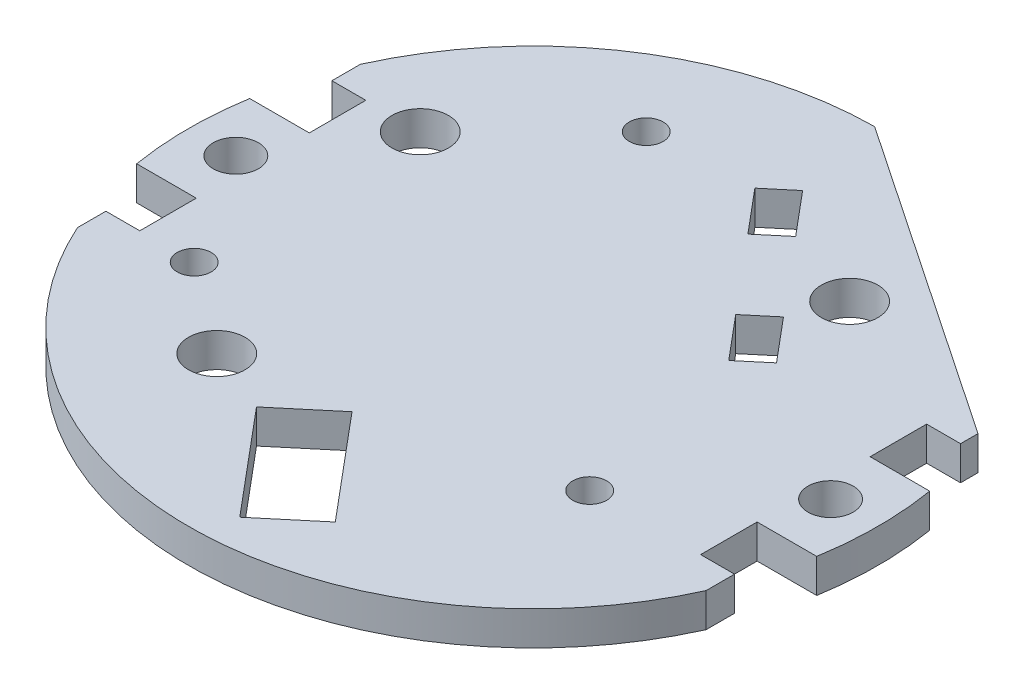
from build123d import *

# Parameters (mm, degrees)
CROQUIS1_R              = 30.5
SALIENTE_EXTRUIR1_DEPTH = 3
CORTAR_EXTRUIR3_START   = -4
CORTAR_EXTRUIR3_DEPTH   = 4
CORTAR_EXTRUIR5_DEPTH   = 4
CROQUIS8_R              = 2.5
CORTAR_EXTRUIR6_DEPTH   = 10
CROQUIS9_R              = 1.5
CORTAR_EXTRUIR7_DEPTH   = 3
CORTAR_EXTRUIR8_START   = -3
CROQUIS10_R             = 2
CORTAR_EXTRUIR8_DEPTH   = 3
CORTAR_EXTRUIR9_START   = -3
CROQUIS11_R             = 2.5
CORTAR_EXTRUIR9_DEPTH   = 3


with BuildPart() as part:
    # Croquis1 → Saliente-Extruir1 (new body)
    with BuildSketch(Plane(origin=(0, 0, 0), x_dir=(1, 0, 0), z_dir=(0, 1, 0))):
        Circle(CROQUIS1_R)
    extrude(amount=SALIENTE_EXTRUIR1_DEPTH)

    # Croquis5 → Cortar-Extruir3 (cut)
    with BuildSketch(Plane(origin=(0, 3, 0), x_dir=(1, 0, 0), z_dir=(0, 1, 0)).offset(CORTAR_EXTRUIR3_START)):
        with BuildLine():
            Line((30.087372767, -5), (24.814059068, -5))
            Line((24.814059068, -5), (24.814059068, -10))
            Line((24.814059068, -10), (28.814059068, -10))
            ThreePointArc((28.814059068, -10), (29.556634924, -7.526973624), (30.087372767, -5))
        make_face()
        with BuildLine():
            Line((24.814059068, 5), (30.087372767, 5))
            ThreePointArc((30.087372767, 5), (29.556634924, 7.526973624), (28.814059068, 10))
            Line((28.814059068, 10), (24.814059068, 10))
            Line((24.814059068, 10), (24.814059068, 5))
        make_face()
        with BuildLine():
            ThreePointArc((-30.087372767, -5), (-29.556634924, -7.526973624), (-28.814059068, -10))
            Line((-28.814059068, -10), (-24.814059068, -10))
            Line((-24.814059068, -10), (-24.814059068, -5))
            Line((-24.814059068, -5), (-30.087372767, -5))
        make_face()
        with BuildLine():
            Line((-24.814059068, 10), (-28.814059068, 10))
            ThreePointArc((-28.814059068, 10), (-29.556634924, 7.526973624), (-30.087372767, 5))
            Line((-30.087372767, 5), (-24.814059068, 5))
            Line((-24.814059068, 5), (-24.814059068, 10))
        make_face()
    extrude(amount=CORTAR_EXTRUIR3_DEPTH, mode=Mode.SUBTRACT)

    # Croquis7 → Cortar-Extruir5 (cut)
    with BuildSketch(Plane(origin=(0, 3, 0), x_dir=(1, 0, 0), z_dir=(0, 1, 0))):
        Polygon((1.428390211, 22.411430151), (-0.869743118, 20.483067322), (2.34419493, 16.652845106), (4.642328259, 18.581207935), align=None)
        Polygon((10.266719844, 11.878319058), (7.968586515, 9.949956229), (11.182524563, 6.119734013), (13.480657893, 8.048096842), align=None)
    extrude(amount=-CORTAR_EXTRUIR5_DEPTH, mode=Mode.SUBTRACT)

    # Croquis8 → Cortar-Extruir6 (cut)
    with BuildSketch(Plane(origin=(0, 3, 0), x_dir=(1, 0, 0), z_dir=(0, 1, 0))):
        with Locations((12, 16)):
            Circle(CROQUIS8_R)
        with Locations((-12, -16)):
            Circle(CROQUIS8_R)
        Polygon((-1.558592329, -14.475370512), (-6.154858987, -18.33209617), (1.558592329, -27.524629488), (6.154858987, -23.66790383), align=None)
    extrude(amount=-CORTAR_EXTRUIR6_DEPTH, mode=Mode.SUBTRACT)

    # Croquis9 → Cortar-Extruir7 (cut)
    with BuildSketch(Plane(origin=(0, 3, 0), x_dir=(1, 0, 0), z_dir=(0, 1, 0))):
        with Locations((-10, 20)):
            Circle(CROQUIS9_R)
        with Locations((-20, -10)):
            Circle(CROQUIS9_R)
        with Locations((15, -10)):
            Circle(CROQUIS9_R)
    extrude(amount=-CORTAR_EXTRUIR7_DEPTH, mode=Mode.SUBTRACT)

    # Croquis10 → Cortar-Extruir8 (cut)
    with BuildSketch(Plane(origin=(0, 3, 0), x_dir=(1, 0, 0), z_dir=(0, 1, 0)).offset(CORTAR_EXTRUIR8_START)):
        with BuildLine():
            Line((-28.814059068, 10), (-27.814059068, 10))
            Line((-27.814059068, 10), (-27.814059068, 12.515115586))
            ThreePointArc((-27.814059068, 12.515115586), (-28.341972277, 11.268655974), (-28.814059068, 10))
        make_face()
        with BuildLine():
            ThreePointArc((28.814059069, 10), (28.341972277, 11.268655974), (27.814059069, 12.515115586))
            Line((27.814059069, 12.515115586), (27.814059069, 10))
            Line((27.814059069, 10), (28.814059069, 10))
        make_face()
        with BuildLine():
            Line((-27.814059068, -12.515115586), (-27.814059068, -10))
            Line((-27.814059068, -10), (-28.814059068, -10))
            ThreePointArc((-28.814059068, -10), (-28.341972277, -11.268655974), (-27.814059068, -12.515115586))
        make_face()
        with BuildLine():
            Line((27.814059069, -10), (27.814059069, -12.515115586))
            ThreePointArc((27.814059069, -12.515115586), (28.341972277, -11.268655974), (28.814059068, -10))
            Line((28.814059068, -10), (27.814059069, -10))
        make_face()
        with Locations((-26.314059068, 0)):
            Circle(CROQUIS10_R)
        with Locations((26.314059069, 0)):
            Circle(CROQUIS10_R)
    extrude(amount=CORTAR_EXTRUIR8_DEPTH, mode=Mode.SUBTRACT)

    # Croquis11 → Cortar-Extruir9 (cut)
    with BuildSketch(Plane(origin=(0, 3, 0), x_dir=(1, 0, 0), z_dir=(0, 1, 0)).offset(CORTAR_EXTRUIR9_START)):
        with BuildLine():
            Line((-0.28585192, 30.498660441), (27.814059069, 11.545031156))
            Line((27.814059069, 11.545031156), (27.814059069, 12.515115586))
            ThreePointArc((27.814059069, 12.515115586), (16.440879496, 25.689442995), (-0.28585192, 30.498660441))
        make_face()
        with Locations((-20, 10)):
            Circle(CROQUIS11_R)
    extrude(amount=CORTAR_EXTRUIR9_DEPTH, mode=Mode.SUBTRACT)


solid = part.part
